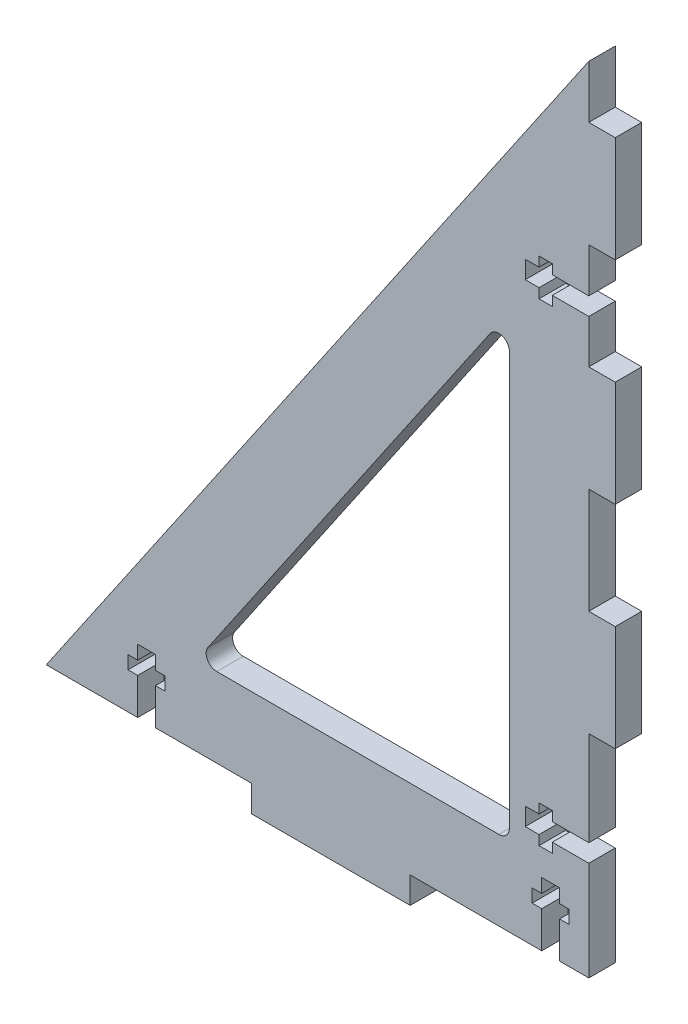
from build123d import *

# Parameters (mm, degrees)
BOSS_EXTRUDE1_DEPTH = 3.175
CUT_EXTRUDE1_DEPTH  = 295.23189409
CUT_EXTRUDE2_DEPTH  = 6.35
SKETCH4_W           = 6.35
SKETCH4_H           = 25.4
BOSS_EXTRUDE2_DEPTH = 6.35
LPATTERN1_COUNT     = 3
LPATTERN1_PITCH     = 50.8
FILLET1_R           = 2.54
SKETCH5_W           = 38.1
SKETCH5_H           = 6.35
BOSS_EXTRUDE3_DEPTH = 6.35


with BuildPart() as part:
    # Sketch1 → Boss-Extrude1 (new, symmetric)
    with BuildSketch(Plane.XY):
        Polygon((69.85, 285.75), (69.85, 95.25), (-60.325, 95.25), align=None)
    extrude(amount=BOSS_EXTRUDE1_DEPTH, both=True)

    # Sketch2 → Cut-Extrude1 (cut, through all)
    with BuildSketch(Plane.XY.offset(3.175)):
        Polygon((-24.23461968, 114.3), (50.8, 114.3), (50.8, 224.106760508), align=None)
    extrude(amount=-CUT_EXTRUDE1_DEPTH, mode=Mode.SUBTRACT)

    # Sketch3 → Cut-Extrude2 (cut)
    with BuildSketch(Plane(origin=(0, 0, -3.175), x_dir=(-1, 0, 0), z_dir=(0, 0, -1))):
        Polygon((-62.827867951, 95.25), (-58.560667951, 95.25), (-58.560667951, 104.013), (-56.249267951, 104.013), (-56.249267951, 107.188), (-58.560667951, 107.188), (-58.560667951, 110.49), (-62.827867951, 110.49), (-62.827867951, 107.188), (-65.139267951, 107.188), (-65.139267951, 104.013), (-62.827867951, 104.013), align=None)
        Polygon((34.12631176, 95.25), (38.39351176, 95.25), (38.39351176, 104.013), (40.70491176, 104.013), (40.70491176, 107.188), (38.39351176, 107.188), (38.39351176, 110.49), (34.12631176, 110.49), (34.12631176, 107.188), (31.81491176, 107.188), (31.81491176, 104.013), (34.12631176, 104.013), align=None)
        Polygon((-69.85, 237.000618256), (-69.85, 232.733418256), (-61.087, 232.733418256), (-61.087, 230.422018256), (-57.912, 230.422018256), (-57.912, 232.733418256), (-54.61, 232.733418256), (-54.61, 237.000618256), (-57.912, 237.000618256), (-57.912, 239.312018256), (-61.087, 239.312018256), (-61.087, 237.000618256), align=None)
        Polygon((-69.85, 123.363816651), (-69.85, 119.096616651), (-61.087, 119.096616651), (-61.087, 116.785216651), (-57.912, 116.785216651), (-57.912, 119.096616651), (-54.61, 119.096616651), (-54.61, 123.363816651), (-57.912, 123.363816651), (-57.912, 125.675216651), (-61.087, 125.675216651), (-61.087, 123.363816651), align=None)
    extrude(amount=-CUT_EXTRUDE2_DEPTH, mode=Mode.SUBTRACT)

    # Sketch4 → Boss-Extrude2 (add)
    with BuildSketch(Plane(origin=(69.85, 0, 0), x_dir=(0, 0, -1), z_dir=(1, 0, 0))):
        with Locations((0, 260.35)):
            Rectangle(SKETCH4_W, SKETCH4_H)
    boss_extrude2 = extrude(amount=BOSS_EXTRUDE2_DEPTH)

    # LPattern1: Boss-Extrude2 ×3
    with Locations(*[(0, -i * LPATTERN1_PITCH, 0) for i in range(1, LPATTERN1_COUNT)]):
        add(boss_extrude2)

    # Fillet1
    fillet1_edges = [part.edges().sort_by_distance(p)[0] for p in [
        (50.8, 224.106760508, 0),
        (50.8, 114.3, 0),
        (-24.23461968, 114.3, 0),
    ]]
    fillet(fillet1_edges, radius=FILLET1_R)

    # Sketch5 → Boss-Extrude3 (add)
    with BuildSketch(Plane(origin=(0, 95.25, 0), x_dir=(-1, 0, 0), z_dir=(0, -1, 0))):
        with Locations((-7.9375, 0)):
            Rectangle(SKETCH5_W, SKETCH5_H)
    extrude(amount=BOSS_EXTRUDE3_DEPTH)


solid = part.part
